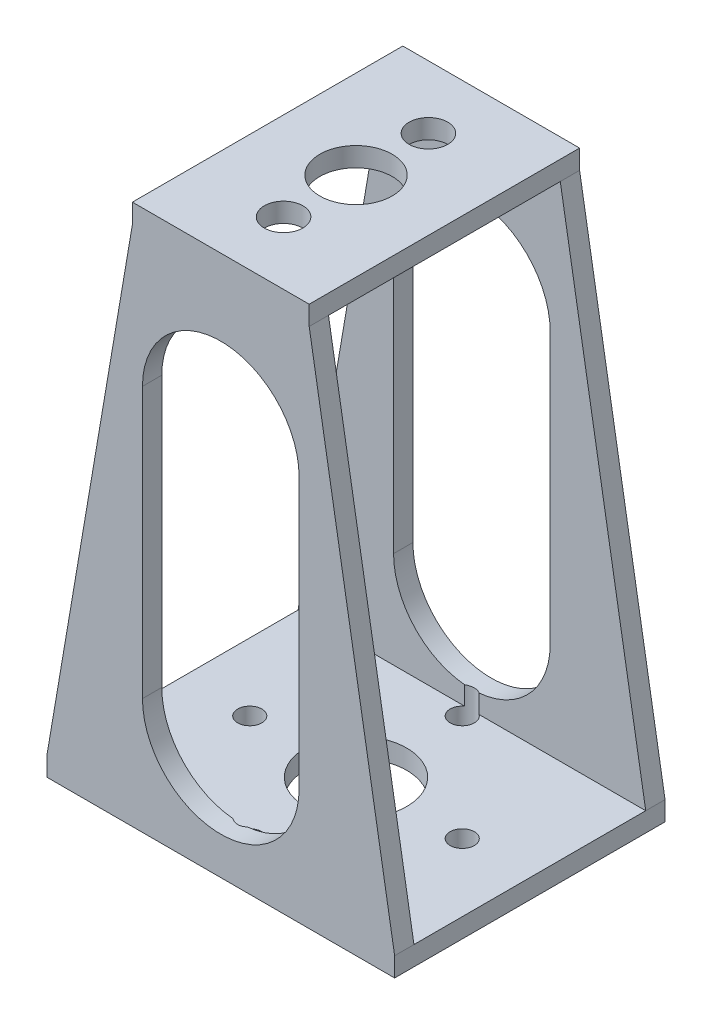
from build123d import *
from build123d.topology import SkipClean

# Parameters (mm, degrees)
SKETCH1_W            = 36
SKETCH1_H            = 28
SKETCH1_R            = 1.25
SKETCH1_R_2          = 5.25
BOSS_EXTRUDE1_DEPTH  = 2
BOSS_EXTRUDE2_DEPTH  = 52
CUT_EXTRUDE1_DEPTH   = 2
MIRROR2_COPY_1_DEPTH = 2
CUT_EXTRUDE2_DEPTH   = 2
SKETCH6_W            = 18.304542046
SKETCH6_H            = 28
SKETCH6_R            = 3.75
SKETCH6_R_2          = 2
BOSS_EXTRUDE3_DEPTH  = 2


# Read off the part's stored shape, not the designer's step: Boss-Extrude2
with BuildPart() as part:
    # Sketch1 → Boss-Extrude1 (new body)
    with BuildSketch(Plane(origin=(0, 0, 0), x_dir=(1, 0, 0), z_dir=(0, 1, 0))):
        with Locations((11, 0)):
            Rectangle(SKETCH1_W, SKETCH1_H)
        with Locations(Location((0, 0, 0), (0, 0, 270))):
            Circle(SKETCH1_R, mode=Mode.SUBTRACT)
        with Locations(Location((22, 0, 0), (0, 0, 270))):
            Circle(SKETCH1_R, mode=Mode.SUBTRACT)
        with Locations(Location((11, 11, 0), (0, 0, 270))):
            Circle(SKETCH1_R, mode=Mode.SUBTRACT)
        with Locations(Location((11, -11, 0), (0, 0, 270))):
            Circle(SKETCH1_R, mode=Mode.SUBTRACT)
        with Locations(Location((11, 0, 0), (0, 0, 270))):
            Circle(SKETCH1_R_2, mode=Mode.SUBTRACT)
    extrude(amount=BOSS_EXTRUDE1_DEPTH)

    # Boss-Extrude2 outline → Boss-Extrude2 (add)
    with SkipClean():  # the faces are left unmerged after this step: merging them gives an invalid solid
        with BuildSketch(Plane(origin=(0, 2, 0), x_dir=(1, 0, 0), z_dir=(0, 1, 0))):
            with BuildLine():
                Line((29, 14), (-7, 14))
                Line((-7, 14), (-7, 12))
                Line((-7, 12), (10.25, 12))
                ThreePointArc((10.25, 12), (11, 12.25), (11.75, 12))
                Line((11.75, 12), (29, 12))
                Line((29, 12), (29, 14))
            make_face()
            with BuildLine():
                Line((10.25, -12), (-7, -12))
                Line((-7, -12), (-7, -14))
                Line((-7, -14), (29, -14))
                Line((29, -14), (29, -12))
                Line((29, -12), (11.75, -12))
                ThreePointArc((11.75, -12), (11, -12.25), (10.25, -12))
            make_face()
        extrude(amount=BOSS_EXTRUDE2_DEPTH)

    # Sketch5 → Cut-Extrude1 (cut)
    with SkipClean():  # the faces are left unmerged after this step: merging them gives an invalid solid
        with BuildSketch(Plane(origin=(0, 0, -14), x_dir=(-1, 0, 0), z_dir=(0, 0, -1))):
            Polygon((-29, 54), (-20.152271023, 54), (-29, 2), align=None)
        cut_extrude1 = extrude(amount=-CUT_EXTRUDE1_DEPTH, mode=Mode.SUBTRACT)

    # Mirror1: Cut-Extrude1 across plane
    with SkipClean():  # the faces are left unmerged after this step: merging them gives an invalid solid
        add(cut_extrude1.mirror(Plane(origin=(11, 0, 0), x_dir=(0, 0, 1), z_dir=(1, 0, 0))), mode=Mode.SUBTRACT)

    # Mirror2: Cut-Extrude1 across plane
    with SkipClean():  # the faces are left unmerged after this step: merging them gives an invalid solid
        add(cut_extrude1.mirror(Plane(origin=(0, 0, 0), x_dir=(1, 0, 0), z_dir=(0, 0, -1))), mode=Mode.SUBTRACT)

    # Mirror2 copy 1 sketch → Mirror2 copy 1 (cut)
    with SkipClean():  # the faces are left unmerged after this step: merging them gives an invalid solid
        with BuildSketch(Plane(origin=(22, 0, 14), x_dir=(1, 0, 0), z_dir=(0, 0, 1))):
            Polygon((-29, 54), (-20.152271023, 54), (-29, 2), align=None)
        extrude(amount=-MIRROR2_COPY_1_DEPTH, mode=Mode.SUBTRACT)

    # Sketch3 → Cut-Extrude2 (cut)
    with SkipClean():  # the faces are left unmerged after this step: merging them gives an invalid solid
        with BuildSketch(Plane(origin=(0, 0, -14), x_dir=(-1, 0, 0), z_dir=(0, 0, -1))):
            with BuildLine():
                Line((-2.889996266, 40), (-2.889996266, 12))
                ThreePointArc((-2.889996266, 12), (-11, 3.889996266), (-19.110003734, 12))
                Line((-19.110003734, 12), (-19.110003734, 40))
                ThreePointArc((-19.110003734, 40), (-11, 48.110003734), (-2.889996266, 40))
            make_face()
        cut_extrude2 = extrude(amount=-CUT_EXTRUDE2_DEPTH, mode=Mode.SUBTRACT)

    # Mirror3: Cut-Extrude2 across plane
    with SkipClean():  # the faces are left unmerged after this step: merging them gives an invalid solid
        add(cut_extrude2.mirror(Plane(origin=(0, 0, 0), x_dir=(1, 0, 0), z_dir=(0, 0, -1))), mode=Mode.SUBTRACT)

    # Sketch6 → Boss-Extrude3 (add)
    with SkipClean():  # the faces are left unmerged after this step: merging them gives an invalid solid
        with BuildSketch(Plane(origin=(0, 54, 0), x_dir=(1, 0, 0), z_dir=(0, 1, 0))):
            with Locations((11, 0)):
                Rectangle(SKETCH6_W, SKETCH6_H)
            with Locations(Location((11, 0, 0), (0, 0, 270))):
                Circle(SKETCH6_R, mode=Mode.SUBTRACT)
            with Locations(Location((11, -7.5, 0), (0, 0, 270))):
                Circle(SKETCH6_R_2, mode=Mode.SUBTRACT)
            with Locations(Location((11, 7.5, 0), (0, 0, 270))):
                Circle(SKETCH6_R_2, mode=Mode.SUBTRACT)
        extrude(amount=BOSS_EXTRUDE3_DEPTH)


solid = part.part
